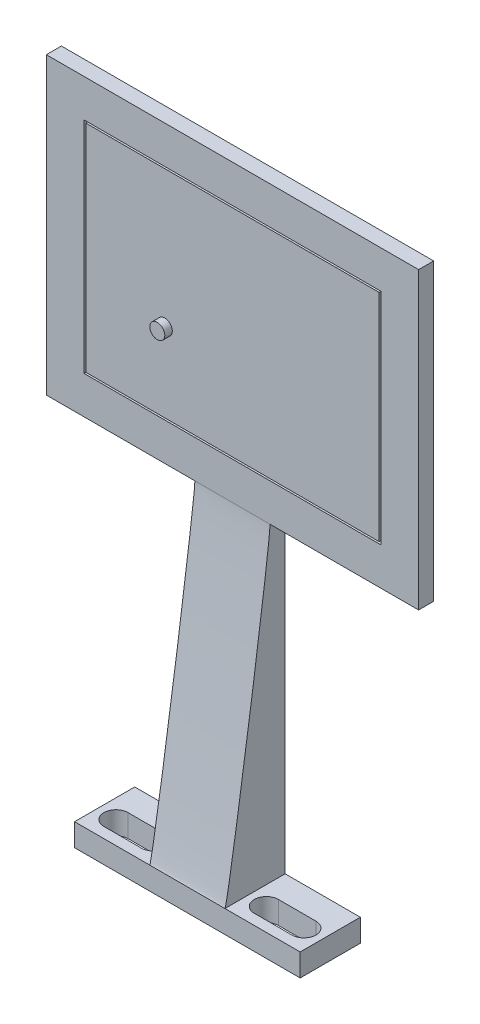
from build123d import *

# Parameters (mm, degrees)
SKETCH1_W            = 39
SKETCH1_H            = 28.7
BOSS_EXTRUDE2_DEPTH  = 1.5
SKETCH3_R            = 1
BOSS_EXTRUDE3_DEPTH  = 1
SKETCH4_W            = 49.5
SKETCH4_H            = 39.2
SKETCH4_W_2          = 39.5
SKETCH4_H_2          = 29.2
BOSS_EXTRUDE4_DEPTH  = 2
SKETCH6_W            = 10
SKETCH6_H            = 2
BOSS_EXTRUDE5_DEPTH  = 41.25
SKETCH7_W            = 10
SKETCH7_H            = 3
SKETCH7_H_2          = 2
BOSS_EXTRUDE10_DEPTH = 3
FILLET5_START        = 14.5
FILLET5_DEPTH        = 10


with BuildPart() as part:
    # Sketch1 → Boss-Extrude2 (new body)
    with BuildSketch(Plane.XY):
        with Locations((19.5, -14.35)):
            Rectangle(SKETCH1_W, SKETCH1_H)
    extrude(amount=BOSS_EXTRUDE2_DEPTH)

    # Sketch3 → Boss-Extrude3 (add)
    with BuildSketch(Plane.XY.offset(1.5)):
        with Locations((10.5, -18.2)):
            Circle(SKETCH3_R)
    extrude(amount=BOSS_EXTRUDE3_DEPTH)


with BuildPart() as body_2:
    # Sketch4 → Boss-Extrude4 (new body)
    with BuildSketch(Plane.XY.offset(1.5)):
        with Locations((19.5, -14.35)):
            Rectangle(SKETCH4_W, SKETCH4_H)
        with Locations((19.5, -14.35)):
            Rectangle(SKETCH4_W_2, SKETCH4_H_2, mode=Mode.SUBTRACT)
    extrude(amount=-BOSS_EXTRUDE4_DEPTH)

    # Sketch6 → Boss-Extrude5 (add)
    with BuildSketch(Plane.XZ.offset(33.95)):
        with Locations((19.5, 0.5)):
            Rectangle(SKETCH6_W, SKETCH6_H)
    extrude(amount=BOSS_EXTRUDE5_DEPTH)

    # Sketch7 → Boss-Extrude10 (add)
    with BuildSketch(Plane.XZ.offset(75.2)):
        with BuildLine():
            Line((13.6, 4.5), (14.5, 4.5))
            Line((14.5, 4.5), (14.5, 7.5))
            Line((14.5, 7.5), (4.5, 7.5))
            Line((4.5, 7.5), (4.5, 4.5))
            Line((4.5, 4.5), (5.4, 4.5))
            ThreePointArc((5.4, 4.5), (5.86862915, 5.63137085), (7, 6.1))
            Line((7, 6.1), (12, 6.1))
            ThreePointArc((12, 6.1), (13.13137085, 5.63137085), (13.6, 4.5))
        make_face()
        with BuildLine():
            Line((4.5, 1.5), (14.5, 1.5))
            Line((14.5, 1.5), (14.5, 4.5))
            Line((14.5, 4.5), (13.6, 4.5))
            ThreePointArc((13.6, 4.5), (13.13137085, 3.36862915), (12, 2.9))
            Line((12, 2.9), (7, 2.9))
            ThreePointArc((7, 2.9), (5.86862915, 3.36862915), (5.4, 4.5))
            Line((5.4, 4.5), (4.5, 4.5))
            Line((4.5, 4.5), (4.5, 1.5))
        make_face()
        with Locations((19.5, 6)):
            Rectangle(SKETCH7_W, SKETCH7_H)
        with Locations((19.5, 3)):
            Rectangle(SKETCH7_W, SKETCH7_H)
        with BuildLine():
            Line((24.5, 4.5), (24.5, 1.5))
            Line((24.5, 1.5), (34.5, 1.5))
            Line((34.5, 1.5), (34.5, 4.5))
            Line((34.5, 4.5), (33.6, 4.5))
            ThreePointArc((33.6, 4.5), (33.13137085, 3.36862915), (32, 2.9))
            Line((32, 2.9), (27, 2.9))
            ThreePointArc((27, 2.9), (25.86862915, 3.36862915), (25.4, 4.5))
            Line((25.4, 4.5), (24.5, 4.5))
        make_face()
        with BuildLine():
            Line((24.5, 7.5), (24.5, 4.5))
            Line((24.5, 4.5), (25.4, 4.5))
            ThreePointArc((25.4, 4.5), (25.86862915, 5.63137085), (27, 6.1))
            Line((27, 6.1), (32, 6.1))
            ThreePointArc((32, 6.1), (33.13137085, 5.63137085), (33.6, 4.5))
            Line((33.6, 4.5), (34.5, 4.5))
            Line((34.5, 4.5), (34.5, 7.5))
            Line((34.5, 7.5), (24.5, 7.5))
        make_face()
        with Locations((29.5, 0.5)):
            Rectangle(SKETCH7_W, SKETCH7_H_2)
        with Locations((19.5, 0.5)):
            Rectangle(SKETCH7_W, SKETCH7_H_2)
        with Locations((9.5, 0.5)):
            Rectangle(SKETCH7_W, SKETCH7_H_2)
    extrude(amount=BOSS_EXTRUDE10_DEPTH)

    # Fillet5: read off the stored shape, not the designer's step
    # Fillet5 outline → Fillet5 (add)
    with BuildSketch(Plane.YZ.offset(FILLET5_START)):
        with BuildLine():
            add(Edge.make_bspline(
                [(-75.2, 7.5), (-75.2, 1.5), (-33.95, 1.5)],
                knots=[0, 0, 0, 1, 1, 1], degree=2, weights=[1, 0.052631579, 1]))
            Line((-75.2, 7.5), (-75.2, 1.5))
            Line((-75.2, 1.5), (-33.95, 1.5))
        make_face()
    extrude(amount=FILLET5_DEPTH)


solid = Compound([part.part, body_2.part])
